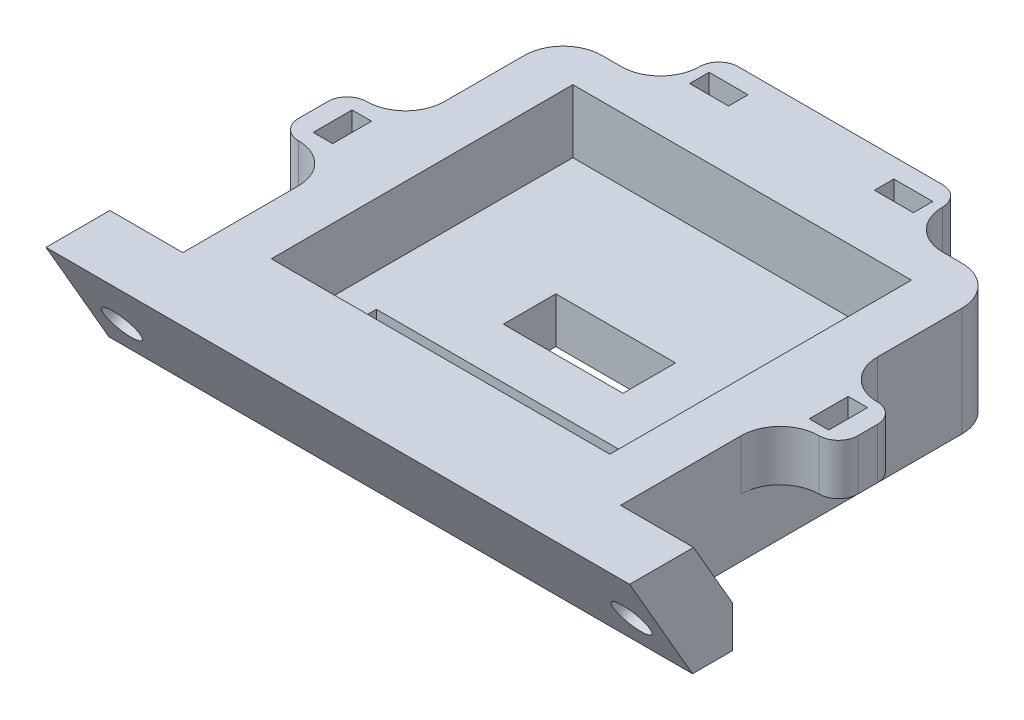
from build123d import *

# Parameters (mm, degrees)
SKETCH2_W           = 57.15
SKETCH2_H           = 49.784
BOSS_EXTRUDE1_DEPTH = 14.224
SKETCH3_W           = 44.196
SKETCH3_H           = 39.37
CUT_EXTRUDE1_DEPTH  = 8.255
SKETCH4_W           = 35.56
SKETCH4_H           = 4.191
SKETCH4_W_2         = 15.621
SKETCH4_H_2         = 6.858
CUT_EXTRUDE2_DEPTH  = 8.255
SKETCH5_W           = 7.62
SKETCH5_H           = 8.89
SKETCH5_H_2         = 7.62
BOSS_EXTRUDE2_DEPTH = 6.604
SKETCH6_W           = 2.54
SKETCH6_H           = 5.08
SKETCH6_W_2         = 5.08
SKETCH6_H_2         = 2.54
CUT_EXTRUDE3_DEPTH  = 6.604
FILLET1_R           = 5.08
FILLET2_R           = 2.54
SKETCH7_W           = 76.2
SKETCH7_H           = 14.224
SKETCH7_R           = 2.38125
BOSS_EXTRUDE3_DEPTH = 5.207
BOSS_EXTRUDE4_DEPTH = 76.2
SKETCH9_R           = 2.413
CUT_EXTRUDE4_DEPTH  = 25.4
CHAMFER1_SIZE       = 5.08
CHAMFER1_SIZE_2     = 8.798818102
CHAMFER2_SIZE       = 5.08
CHAMFER2_SIZE_2     = 8.798818102
FILLET3_R           = 5.08
FILLET4_R           = 5.08


# Some blends are built 0.0001 mm under size
with BuildPart() as part:
    # Sketch2 → Boss-Extrude1 (new body)
    with BuildSketch(Plane(origin=(0, 0, 0), x_dir=(1, 0, 0), z_dir=(0, 1, 0))):
        with Locations((28.575, 24.892)):
            Rectangle(SKETCH2_W, SKETCH2_H)
    extrude(amount=BOSS_EXTRUDE1_DEPTH)

    # Sketch3 → Cut-Extrude1 (cut)
    with BuildSketch(Plane(origin=(0, 14.224, 0), x_dir=(1, 0, 0), z_dir=(0, 1, 0))):
        with Locations((28.575, 24.892)):
            Rectangle(SKETCH3_W, SKETCH3_H)
    extrude(amount=-CUT_EXTRUDE1_DEPTH, mode=Mode.SUBTRACT)

    # Sketch4 → Cut-Extrude2 (cut)
    with BuildSketch(Plane(origin=(0, 5.969, 0), x_dir=(1, 0, 0), z_dir=(0, 1, 0))):
        with Locations((28.575, 12.5095)):
            Rectangle(SKETCH4_W, SKETCH4_H)
        with Locations((28.575, 24.638)):
            Rectangle(SKETCH4_W_2, SKETCH4_H_2)
    extrude(amount=-CUT_EXTRUDE2_DEPTH, mode=Mode.SUBTRACT)

    # Sketch5 → Boss-Extrude2 (add)
    with BuildSketch(Plane(origin=(0, 14.224, 0), x_dir=(1, 0, 0), z_dir=(0, 1, 0))):
        with Locations((-3.81, 24.765)):
            Rectangle(SKETCH5_W, SKETCH5_H)
        Polygon((12.7, 49.784), (36.83, 49.784), (44.45, 49.784), (44.45, 57.404), (36.83, 57.404), (12.7, 57.404), align=None)
        with Locations((60.96, 24.765)):
            Rectangle(SKETCH5_W, SKETCH5_H_2)
    extrude(amount=-BOSS_EXTRUDE2_DEPTH)

    # Sketch6 → Cut-Extrude3 (cut)
    with BuildSketch(Plane(origin=(0, 14.224, 0), x_dir=(1, 0, 0), z_dir=(0, 1, 0))):
        with Locations((-3.81, 24.765)):
            Rectangle(SKETCH6_W, SKETCH6_H)
        with Locations((60.96, 24.765)):
            Rectangle(SKETCH6_W, SKETCH6_H)
        with Locations((16.51, 53.594)):
            Rectangle(SKETCH6_W_2, SKETCH6_H_2)
        with Locations((40.64, 53.594)):
            Rectangle(SKETCH6_W_2, SKETCH6_H_2)
    extrude(amount=-CUT_EXTRUDE3_DEPTH, mode=Mode.SUBTRACT)

    # Fillet1
    fillet1_edges = [part.edges().sort_by_distance(p)[0] for p in [
        (0, 7.112, -49.784),
        (57.15, 7.112, -49.784),
        (57.15, 7.112, 0),
        (0, 7.112, 0),
    ]]
    fillet(fillet1_edges, radius=FILLET1_R)

    # Fillet2
    fillet2_edges = [part.edges().sort_by_distance(p)[0] for p in [
        (-7.62, 10.922, -20.32),
        (-7.62, 10.922, -29.21),
        (12.7, 10.922, -57.404),
        (44.45, 10.922, -57.404),
        (64.77, 10.922, -28.575),
        (64.77, 10.922, -20.955),
    ]]
    fillet(fillet2_edges, radius=FILLET2_R)

    # Sketch7 → Boss-Extrude3 (add)
    with BuildSketch(Plane.XY):
        with Locations((28.575, 7.112)):
            Rectangle(SKETCH7_W, SKETCH7_H)
        with Locations((-5.461, 7.112)):
            Circle(SKETCH7_R, mode=Mode.SUBTRACT)
        with Locations((62.611, 7.112)):
            Circle(SKETCH7_R, mode=Mode.SUBTRACT)
    extrude(amount=-BOSS_EXTRUDE3_DEPTH)

    # Sketch8 → Boss-Extrude4 (add)
    with BuildSketch(Plane.ZY.offset(9.525)):
        Polygon((-5.207, 0), (-5.207, 14.224), (8.212230229, 14.224), (0, 0), align=None)
    extrude(amount=-BOSS_EXTRUDE4_DEPTH)

    # Sketch9 → Cut-Extrude4 (cut)
    with BuildSketch(Plane(origin=(0, 0, 0), x_dir=(1, 0, 0), z_dir=(0, -0.5000000000000043, 0.8660254037844363))):
        with Locations(Location((-4.699, 6.264460458, 0), (0, 0, 270))):
            Circle(SKETCH9_R)
        with Locations(Location((61.849, 6.264460458, 0), (0, 0, 270))):
            Circle(SKETCH9_R)
    extrude(amount=-CUT_EXTRUDE4_DEPTH, mode=Mode.SUBTRACT)

    # Chamfer1
    # the kernel refuses this chamfer: 8.798818102, 5.08 mm, written as the material it takes off along each edge
    with BuildSketch(Plane(origin=(57.15, 14.224, -5.207), x_dir=(0, 0.05789386240267539, 0.9983227437537924), z_dir=(1, 0, 0))) as chamfer1_piece_1:
        Polygon((CHAMFER1_SIZE * 0.998322743754, CHAMFER1_SIZE * 0.0578938624027), (-CHAMFER1_SIZE_2 * 0.0578938624056, CHAMFER1_SIZE_2 * 0.998322743805), (0, 0), align=None)
    extrude(amount=32.288296971, mode=Mode.SUBTRACT)

    # Chamfer2
    # the kernel refuses this chamfer: 8.798818102, 5.08 mm, written as the material it takes off along each edge
    with BuildSketch(Plane(origin=(-32.288296971, 14.224, -5.207), x_dir=(0, 0.05789386240267139, 0.9983227437537925), z_dir=(1, 0, 0))) as chamfer2_piece_1:
        Polygon((CHAMFER2_SIZE * 0.998322743754, CHAMFER2_SIZE * 0.0578938624027), (-CHAMFER2_SIZE_2 * 0.0578938624056, CHAMFER2_SIZE_2 * 0.998322743805), (0, 0), align=None)
    extrude(amount=32.288296971, mode=Mode.SUBTRACT)

    # Fillet3
    fillet3_edges = [part.edges().sort_by_distance(p)[0] for p in [
        (44.45, 10.922, -49.784),
        (12.7, 10.922, -49.784),
    ]]
    fillet(fillet3_edges, radius=FILLET3_R - 0.0001)  # a hair under: the kernel refuses the full size

    # Fillet4
    fillet4_edges = [part.edges().sort_by_distance(p)[0] for p in [
        (57.15, 10.922, -20.955),
        (57.15, 10.922, -28.575),
        (0, 10.922, -29.21),
        (0, 10.922, -20.32),
    ]]
    fillet(fillet4_edges, radius=FILLET4_R - 0.0001)  # a hair under: the kernel refuses the full size


solid = part.part
